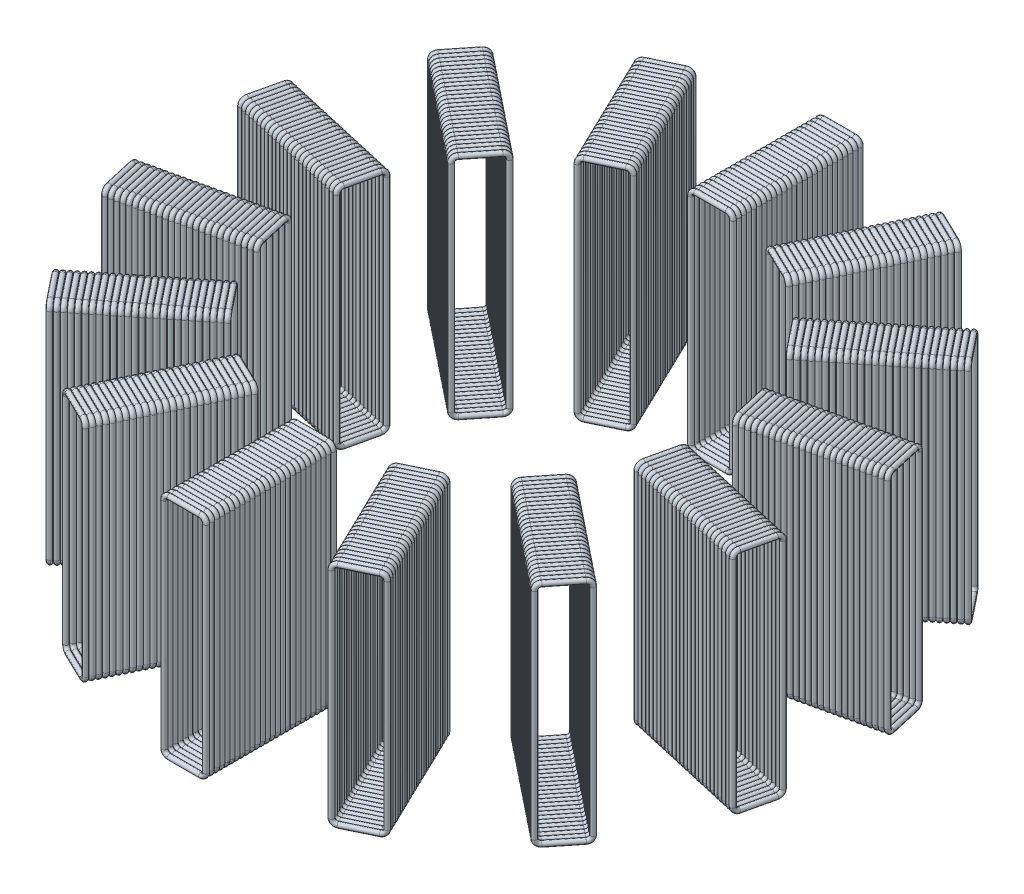
from build123d import *

# Parameters (mm, degrees)
SWEEP_1_PROFILE_R           = 0.1
PATTERN_LINEAR_2_COUNT      = 26
PATTERN_LINEAR_2_PITCH      = 0.2
PATTERN_CIRCULAR_1_COUNT    = 14
PATTERN_CIRCULAR_1_2_COUNT  = 14
PATTERN_CIRCULAR_1_3_COUNT  = 14
PATTERN_CIRCULAR_1_4_COUNT  = 14
PATTERN_CIRCULAR_1_5_COUNT  = 14
PATTERN_CIRCULAR_1_6_COUNT  = 14
PATTERN_CIRCULAR_1_7_COUNT  = 14
PATTERN_CIRCULAR_1_8_COUNT  = 14
PATTERN_CIRCULAR_1_9_COUNT  = 14
PATTERN_CIRCULAR_1_10_COUNT = 14
PATTERN_CIRCULAR_1_11_COUNT = 14
PATTERN_CIRCULAR_1_12_COUNT = 14
PATTERN_CIRCULAR_1_13_COUNT = 14
PATTERN_CIRCULAR_1_14_COUNT = 14
PATTERN_CIRCULAR_1_15_COUNT = 14
PATTERN_CIRCULAR_1_16_COUNT = 14
PATTERN_CIRCULAR_1_17_COUNT = 14
PATTERN_CIRCULAR_1_18_COUNT = 14
PATTERN_CIRCULAR_1_19_COUNT = 14
PATTERN_CIRCULAR_1_20_COUNT = 14
PATTERN_CIRCULAR_1_21_COUNT = 14
PATTERN_CIRCULAR_1_22_COUNT = 14
PATTERN_CIRCULAR_1_23_COUNT = 14
PATTERN_CIRCULAR_1_24_COUNT = 14
PATTERN_CIRCULAR_1_25_COUNT = 14
PATTERN_CIRCULAR_1_26_COUNT = 14


with BuildPart() as part:
    # По траектории1: sweep along a path in Эскиз1
    with BuildLine(Plane.XY) as sweep_1_path:
        Line((-0.625, -4.45), (0.625, -4.45))
        ThreePointArc((0.625, -4.45), (0.766421356, -4.391421356), (0.825, -4.25))
        Line((0.825, -4.25), (0.825, 4.25))
        ThreePointArc((0.825, 4.25), (0.766421356, 4.391421356), (0.625, 4.45))
        Line((0.625, 4.45), (-0.625, 4.45))
        ThreePointArc((-0.625, 4.45), (-0.766421356, 4.391421356), (-0.825, 4.25))
        Line((-0.825, 4.25), (-0.825, -4.25))
        ThreePointArc((-0.825, -4.25), (-0.766421356, -4.391421356), (-0.625, -4.45))
    # По траектории1 profile (on start of the path) → По траектории1 (sweep)
    with BuildSketch(Plane(origin=(-0.625, -4.45, 0), x_dir=(0, 0, 1), z_dir=(1, 0, 0))):
        Circle(SWEEP_1_PROFILE_R)
    sweep(path=sweep_1_path.line)


with BuildPart() as pattern_linear_2_1:
    # Линейный массив2: pattern copy
    add(part.part.moved(Location(Vector(0, 0, 1) * (1 * PATTERN_LINEAR_2_PITCH))))

    # Pattern Circular 1 25: Линейный массив2_1 ×14 about axis
    pattern_circular_1_25_axis = Axis((0, 0, -7.9), (0, 1, 0))


with BuildPart() as pattern_linear_2_2:
    # Линейный массив2: pattern copy
    add(part.part.moved(Location(Vector(0, 0, 1) * (2 * PATTERN_LINEAR_2_PITCH))))

    # Pattern Circular 1 24: Линейный массив2_2 ×14 about axis
    pattern_circular_1_24_axis = Axis((0, 0, -7.9), (0, 1, 0))


with BuildPart() as pattern_linear_2_3:
    # Линейный массив2: pattern copy
    add(part.part.moved(Location(Vector(0, 0, 1) * (3 * PATTERN_LINEAR_2_PITCH))))

    # Pattern Circular 1 23: Линейный массив2_3 ×14 about axis
    pattern_circular_1_23_axis = Axis((0, 0, -7.9), (0, 1, 0))


with BuildPart() as pattern_linear_2_4:
    # Линейный массив2: pattern copy
    add(part.part.moved(Location(Vector(0, 0, 1) * (4 * PATTERN_LINEAR_2_PITCH))))

    # Pattern Circular 1 22: Линейный массив2_4 ×14 about axis
    pattern_circular_1_22_axis = Axis((0, 0, -7.9), (0, 1, 0))


with BuildPart() as pattern_linear_2_5:
    # Линейный массив2: pattern copy
    add(part.part.moved(Location(Vector(0, 0, 1) * (5 * PATTERN_LINEAR_2_PITCH))))

    # Pattern Circular 1 20: Линейный массив2_5 ×14 about axis
    pattern_circular_1_20_axis = Axis((0, 0, -7.9), (0, 1, 0))


with BuildPart() as pattern_linear_2_6:
    # Линейный массив2: pattern copy
    add(part.part.moved(Location(Vector(0, 0, 1) * (6 * PATTERN_LINEAR_2_PITCH))))

    # Pattern Circular 1 21: Линейный массив2_6 ×14 about axis
    pattern_circular_1_21_axis = Axis((0, 0, -7.9), (0, 1, 0))


with BuildPart() as pattern_linear_2_7:
    # Линейный массив2: pattern copy
    add(part.part.moved(Location(Vector(0, 0, 1) * (7 * PATTERN_LINEAR_2_PITCH))))

    # Pattern Circular 1 19: Линейный массив2_7 ×14 about axis
    pattern_circular_1_19_axis = Axis((0, 0, -7.9), (0, 1, 0))


with BuildPart() as pattern_linear_2_8:
    # Линейный массив2: pattern copy
    add(part.part.moved(Location(Vector(0, 0, 1) * (8 * PATTERN_LINEAR_2_PITCH))))

    # Pattern Circular 1 18: Линейный массив2_8 ×14 about axis
    pattern_circular_1_18_axis = Axis((0, 0, -7.9), (0, 1, 0))


with BuildPart() as pattern_linear_2_9:
    # Линейный массив2: pattern copy
    add(part.part.moved(Location(Vector(0, 0, 1) * (9 * PATTERN_LINEAR_2_PITCH))))

    # Pattern Circular 1 17: Линейный массив2_9 ×14 about axis
    pattern_circular_1_17_axis = Axis((0, 0, -7.9), (0, 1, 0))


with BuildPart() as pattern_linear_2_10:
    # Линейный массив2: pattern copy
    add(part.part.moved(Location(Vector(0, 0, 1) * (10 * PATTERN_LINEAR_2_PITCH))))

    # Pattern Circular 1 16: Линейный массив2_10 ×14 about axis
    pattern_circular_1_16_axis = Axis((0, 0, -7.9), (0, 1, 0))


with BuildPart() as pattern_linear_2_11:
    # Линейный массив2: pattern copy
    add(part.part.moved(Location(Vector(0, 0, 1) * (11 * PATTERN_LINEAR_2_PITCH))))

    # Pattern Circular 1 15: Линейный массив2_11 ×14 about axis
    pattern_circular_1_15_axis = Axis((0, 0, -7.9), (0, 1, 0))


with BuildPart() as pattern_linear_2_12:
    # Линейный массив2: pattern copy
    add(part.part.moved(Location(Vector(0, 0, 1) * (12 * PATTERN_LINEAR_2_PITCH))))

    # Pattern Circular 1 14: Линейный массив2_12 ×14 about axis
    pattern_circular_1_14_axis = Axis((0, 0, -7.9), (0, 1, 0))


with BuildPart() as pattern_linear_2_13:
    # Линейный массив2: pattern copy
    add(part.part.moved(Location(Vector(0, 0, 1) * (13 * PATTERN_LINEAR_2_PITCH))))

    # Pattern Circular 1 13: Линейный массив2_13 ×14 about axis
    pattern_circular_1_13_axis = Axis((0, 0, -7.9), (0, 1, 0))


with BuildPart() as pattern_linear_2_14:
    # Линейный массив2: pattern copy
    add(part.part.moved(Location(Vector(0, 0, 1) * (14 * PATTERN_LINEAR_2_PITCH))))

    # Pattern Circular 1 12: Линейный массив2_14 ×14 about axis
    pattern_circular_1_12_axis = Axis((0, 0, -7.9), (0, 1, 0))


with BuildPart() as pattern_linear_2_15:
    # Линейный массив2: pattern copy
    add(part.part.moved(Location(Vector(0, 0, 1) * (15 * PATTERN_LINEAR_2_PITCH))))

    # Pattern Circular 1 11: Линейный массив2_15 ×14 about axis
    pattern_circular_1_11_axis = Axis((0, 0, -7.9), (0, 1, 0))


with BuildPart() as pattern_linear_2_16:
    # Линейный массив2: pattern copy
    add(part.part.moved(Location(Vector(0, 0, 1) * (16 * PATTERN_LINEAR_2_PITCH))))

    # Pattern Circular 1 10: Линейный массив2_16 ×14 about axis
    pattern_circular_1_10_axis = Axis((0, 0, -7.9), (0, 1, 0))


with BuildPart() as pattern_linear_2_17:
    # Линейный массив2: pattern copy
    add(part.part.moved(Location(Vector(0, 0, 1) * (17 * PATTERN_LINEAR_2_PITCH))))

    # Pattern Circular 1 9: Линейный массив2_17 ×14 about axis
    pattern_circular_1_9_axis = Axis((0, 0, -7.9), (0, 1, 0))


with BuildPart() as pattern_linear_2_18:
    # Линейный массив2: pattern copy
    add(part.part.moved(Location(Vector(0, 0, 1) * (18 * PATTERN_LINEAR_2_PITCH))))

    # Pattern Circular 1 8: Линейный массив2_18 ×14 about axis
    pattern_circular_1_8_axis = Axis((0, 0, -7.9), (0, 1, 0))


with BuildPart() as pattern_linear_2_19:
    # Линейный массив2: pattern copy
    add(part.part.moved(Location(Vector(0, 0, 1) * (19 * PATTERN_LINEAR_2_PITCH))))

    # Pattern Circular 1 7: Линейный массив2_19 ×14 about axis
    pattern_circular_1_7_axis = Axis((0, 0, -7.9), (0, 1, 0))


with BuildPart() as pattern_linear_2_20:
    # Линейный массив2: pattern copy
    add(part.part.moved(Location(Vector(0, 0, 1) * (20 * PATTERN_LINEAR_2_PITCH))))

    # Pattern Circular 1 5: Линейный массив2_20 ×14 about axis
    pattern_circular_1_5_axis = Axis((0, 0, -7.9), (0, 1, 0))


with BuildPart() as pattern_linear_2_21:
    # Линейный массив2: pattern copy
    add(part.part.moved(Location(Vector(0, 0, 1) * (21 * PATTERN_LINEAR_2_PITCH))))

    # Pattern Circular 1 6: Линейный массив2_21 ×14 about axis
    pattern_circular_1_6_axis = Axis((0, 0, -7.9), (0, 1, 0))


with BuildPart() as pattern_linear_2_22:
    # Линейный массив2: pattern copy
    add(part.part.moved(Location(Vector(0, 0, 1) * (22 * PATTERN_LINEAR_2_PITCH))))

    # Pattern Circular 1 4: Линейный массив2_22 ×14 about axis
    pattern_circular_1_4_axis = Axis((0, 0, -7.9), (0, 1, 0))


with BuildPart() as pattern_linear_2_23:
    # Линейный массив2: pattern copy
    add(part.part.moved(Location(Vector(0, 0, 1) * (23 * PATTERN_LINEAR_2_PITCH))))

    # Pattern Circular 1 3: Линейный массив2_23 ×14 about axis
    pattern_circular_1_3_axis = Axis((0, 0, -7.9), (0, 1, 0))


with BuildPart() as pattern_linear_2_24:
    # Линейный массив2: pattern copy
    add(part.part.moved(Location(Vector(0, 0, 1) * (24 * PATTERN_LINEAR_2_PITCH))))

    # Pattern Circular 1 2: Линейный массив2_24 ×14 about axis
    pattern_circular_1_2_axis = Axis((0, 0, -7.9), (0, 1, 0))


with BuildPart() as pattern_linear_2_25:
    # Линейный массив2: pattern copy
    add(part.part.moved(Location(Vector(0, 0, 1) * (25 * PATTERN_LINEAR_2_PITCH))))

    # Круговой массив1: Линейный массив2_25 ×14 about axis
    pattern_circular_1_axis = Axis((0, 0, -7.9), (0, 1, 0))


with BuildPart() as pattern_linear_2_25_1:
    add(pattern_linear_2_25.part)
    for i in range(1, PATTERN_CIRCULAR_1_COUNT):
        add(pattern_linear_2_25.part.rotate(pattern_circular_1_axis, i * 360 / PATTERN_CIRCULAR_1_COUNT))


with BuildPart() as pattern_linear_2_24_1:
    add(pattern_linear_2_24.part)
    for i in range(1, PATTERN_CIRCULAR_1_2_COUNT):
        add(pattern_linear_2_24.part.rotate(pattern_circular_1_2_axis, i * 360 / PATTERN_CIRCULAR_1_2_COUNT))


with BuildPart() as pattern_linear_2_23_1:
    add(pattern_linear_2_23.part)
    for i in range(1, PATTERN_CIRCULAR_1_3_COUNT):
        add(pattern_linear_2_23.part.rotate(pattern_circular_1_3_axis, i * 360 / PATTERN_CIRCULAR_1_3_COUNT))


with BuildPart() as pattern_linear_2_22_1:
    add(pattern_linear_2_22.part)
    for i in range(1, PATTERN_CIRCULAR_1_4_COUNT):
        add(pattern_linear_2_22.part.rotate(pattern_circular_1_4_axis, i * 360 / PATTERN_CIRCULAR_1_4_COUNT))


with BuildPart() as pattern_linear_2_20_1:
    add(pattern_linear_2_20.part)
    for i in range(1, PATTERN_CIRCULAR_1_5_COUNT):
        add(pattern_linear_2_20.part.rotate(pattern_circular_1_5_axis, i * 360 / PATTERN_CIRCULAR_1_5_COUNT))


with BuildPart() as pattern_linear_2_21_1:
    add(pattern_linear_2_21.part)
    for i in range(1, PATTERN_CIRCULAR_1_6_COUNT):
        add(pattern_linear_2_21.part.rotate(pattern_circular_1_6_axis, i * 360 / PATTERN_CIRCULAR_1_6_COUNT))


with BuildPart() as pattern_linear_2_19_1:
    add(pattern_linear_2_19.part)
    for i in range(1, PATTERN_CIRCULAR_1_7_COUNT):
        add(pattern_linear_2_19.part.rotate(pattern_circular_1_7_axis, i * 360 / PATTERN_CIRCULAR_1_7_COUNT))


with BuildPart() as pattern_linear_2_18_1:
    add(pattern_linear_2_18.part)
    for i in range(1, PATTERN_CIRCULAR_1_8_COUNT):
        add(pattern_linear_2_18.part.rotate(pattern_circular_1_8_axis, i * 360 / PATTERN_CIRCULAR_1_8_COUNT))


with BuildPart() as pattern_linear_2_17_1:
    add(pattern_linear_2_17.part)
    for i in range(1, PATTERN_CIRCULAR_1_9_COUNT):
        add(pattern_linear_2_17.part.rotate(pattern_circular_1_9_axis, i * 360 / PATTERN_CIRCULAR_1_9_COUNT))


with BuildPart() as pattern_linear_2_16_1:
    add(pattern_linear_2_16.part)
    for i in range(1, PATTERN_CIRCULAR_1_10_COUNT):
        add(pattern_linear_2_16.part.rotate(pattern_circular_1_10_axis, i * 360 / PATTERN_CIRCULAR_1_10_COUNT))


with BuildPart() as pattern_linear_2_15_1:
    add(pattern_linear_2_15.part)
    for i in range(1, PATTERN_CIRCULAR_1_11_COUNT):
        add(pattern_linear_2_15.part.rotate(pattern_circular_1_11_axis, i * 360 / PATTERN_CIRCULAR_1_11_COUNT))


with BuildPart() as pattern_linear_2_14_1:
    add(pattern_linear_2_14.part)
    for i in range(1, PATTERN_CIRCULAR_1_12_COUNT):
        add(pattern_linear_2_14.part.rotate(pattern_circular_1_12_axis, i * 360 / PATTERN_CIRCULAR_1_12_COUNT))


with BuildPart() as pattern_linear_2_13_1:
    add(pattern_linear_2_13.part)
    for i in range(1, PATTERN_CIRCULAR_1_13_COUNT):
        add(pattern_linear_2_13.part.rotate(pattern_circular_1_13_axis, i * 360 / PATTERN_CIRCULAR_1_13_COUNT))


with BuildPart() as pattern_linear_2_12_1:
    add(pattern_linear_2_12.part)
    for i in range(1, PATTERN_CIRCULAR_1_14_COUNT):
        add(pattern_linear_2_12.part.rotate(pattern_circular_1_14_axis, i * 360 / PATTERN_CIRCULAR_1_14_COUNT))


with BuildPart() as pattern_linear_2_11_1:
    add(pattern_linear_2_11.part)
    for i in range(1, PATTERN_CIRCULAR_1_15_COUNT):
        add(pattern_linear_2_11.part.rotate(pattern_circular_1_15_axis, i * 360 / PATTERN_CIRCULAR_1_15_COUNT))


with BuildPart() as pattern_linear_2_10_1:
    add(pattern_linear_2_10.part)
    for i in range(1, PATTERN_CIRCULAR_1_16_COUNT):
        add(pattern_linear_2_10.part.rotate(pattern_circular_1_16_axis, i * 360 / PATTERN_CIRCULAR_1_16_COUNT))


with BuildPart() as pattern_linear_2_9_1:
    add(pattern_linear_2_9.part)
    for i in range(1, PATTERN_CIRCULAR_1_17_COUNT):
        add(pattern_linear_2_9.part.rotate(pattern_circular_1_17_axis, i * 360 / PATTERN_CIRCULAR_1_17_COUNT))


with BuildPart() as pattern_linear_2_8_1:
    add(pattern_linear_2_8.part)
    for i in range(1, PATTERN_CIRCULAR_1_18_COUNT):
        add(pattern_linear_2_8.part.rotate(pattern_circular_1_18_axis, i * 360 / PATTERN_CIRCULAR_1_18_COUNT))


with BuildPart() as pattern_linear_2_7_1:
    add(pattern_linear_2_7.part)
    for i in range(1, PATTERN_CIRCULAR_1_19_COUNT):
        add(pattern_linear_2_7.part.rotate(pattern_circular_1_19_axis, i * 360 / PATTERN_CIRCULAR_1_19_COUNT))


with BuildPart() as pattern_linear_2_5_1:
    add(pattern_linear_2_5.part)
    for i in range(1, PATTERN_CIRCULAR_1_20_COUNT):
        add(pattern_linear_2_5.part.rotate(pattern_circular_1_20_axis, i * 360 / PATTERN_CIRCULAR_1_20_COUNT))


with BuildPart() as pattern_linear_2_6_1:
    add(pattern_linear_2_6.part)
    for i in range(1, PATTERN_CIRCULAR_1_21_COUNT):
        add(pattern_linear_2_6.part.rotate(pattern_circular_1_21_axis, i * 360 / PATTERN_CIRCULAR_1_21_COUNT))


with BuildPart() as pattern_linear_2_4_1:
    add(pattern_linear_2_4.part)
    for i in range(1, PATTERN_CIRCULAR_1_22_COUNT):
        add(pattern_linear_2_4.part.rotate(pattern_circular_1_22_axis, i * 360 / PATTERN_CIRCULAR_1_22_COUNT))


with BuildPart() as pattern_linear_2_3_1:
    add(pattern_linear_2_3.part)
    for i in range(1, PATTERN_CIRCULAR_1_23_COUNT):
        add(pattern_linear_2_3.part.rotate(pattern_circular_1_23_axis, i * 360 / PATTERN_CIRCULAR_1_23_COUNT))


with BuildPart() as pattern_linear_2_2_1:
    add(pattern_linear_2_2.part)
    for i in range(1, PATTERN_CIRCULAR_1_24_COUNT):
        add(pattern_linear_2_2.part.rotate(pattern_circular_1_24_axis, i * 360 / PATTERN_CIRCULAR_1_24_COUNT))


with BuildPart() as pattern_linear_2_1_1:
    add(pattern_linear_2_1.part)
    for i in range(1, PATTERN_CIRCULAR_1_25_COUNT):
        add(pattern_linear_2_1.part.rotate(pattern_circular_1_25_axis, i * 360 / PATTERN_CIRCULAR_1_25_COUNT))


with BuildPart() as part_1:
    add(part.part)

    # Pattern Circular 1 26: part ×14 about axis
    pattern_circular_1_26_axis = Axis((0, 0, -7.9), (0, 1, 0))


with BuildPart() as part_2:
    add(part_1.part)
    for i in range(1, PATTERN_CIRCULAR_1_26_COUNT):
        add(part_1.part.rotate(pattern_circular_1_26_axis, i * 360 / PATTERN_CIRCULAR_1_26_COUNT))


solid = Compound([pattern_linear_2_25_1.part, pattern_linear_2_24_1.part, pattern_linear_2_23_1.part, pattern_linear_2_22_1.part, pattern_linear_2_20_1.part, pattern_linear_2_21_1.part, pattern_linear_2_19_1.part, pattern_linear_2_18_1.part, pattern_linear_2_17_1.part, pattern_linear_2_16_1.part, pattern_linear_2_15_1.part, pattern_linear_2_14_1.part, pattern_linear_2_13_1.part, pattern_linear_2_12_1.part, pattern_linear_2_11_1.part, pattern_linear_2_10_1.part, pattern_linear_2_9_1.part, pattern_linear_2_8_1.part, pattern_linear_2_7_1.part, pattern_linear_2_5_1.part, pattern_linear_2_6_1.part, pattern_linear_2_4_1.part, pattern_linear_2_3_1.part, pattern_linear_2_2_1.part, pattern_linear_2_1_1.part, part_2.part])
